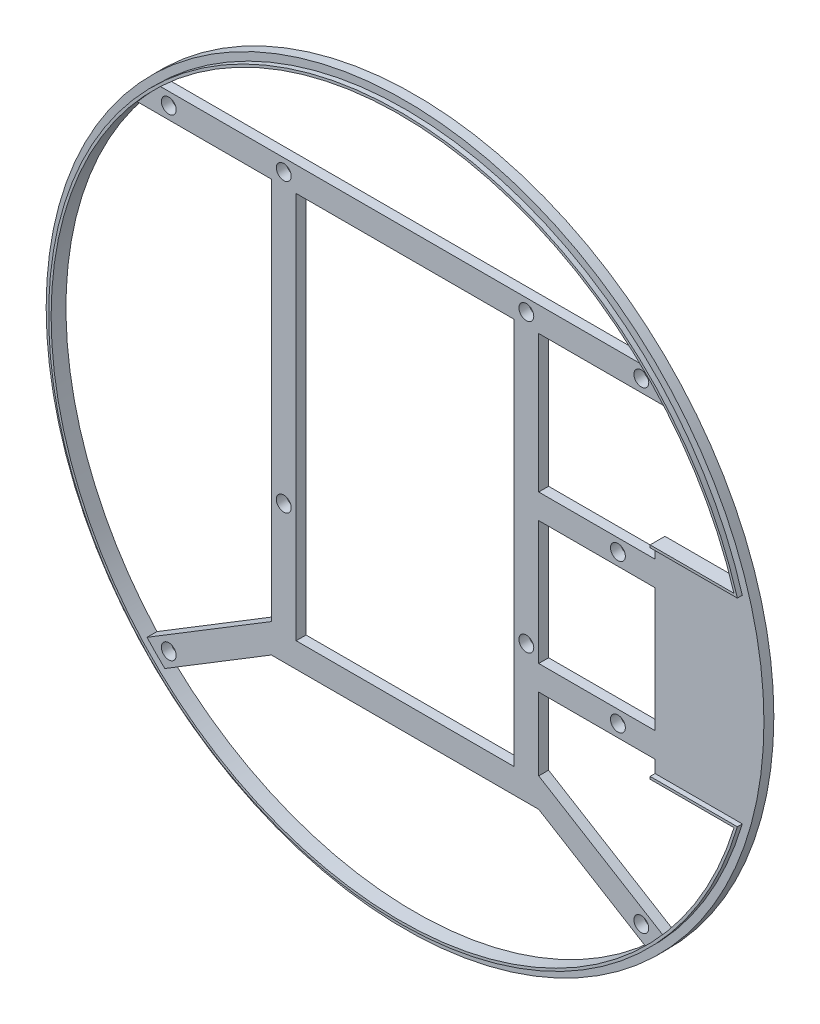
from build123d import *
from build123d.topology import SkipClean

# Parameters (mm, degrees)
SKIZZE1_R             = 72.5
SKIZZE1_R_2           = 70.5
BASE_RING_DEPTH       = 2
RASPBERRY_FRAME_DEPTH = 2
SCREWS_I_D            = 3
SKIZZE6_R             = 1.5
CAMERA_BEAM_DEPTH     = 2
BOTTOM_START          = -2
BOTTOM_COVER_DEPTH    = 2
INNER_RING_DEPTH      = 1


with BuildPart() as part:
    # Skizze1 → Base Ring (new body)
    with BuildSketch(Plane.XY):
        Circle(SKIZZE1_R)
        Circle(SKIZZE1_R_2, mode=Mode.SUBTRACT)
    extrude(amount=BASE_RING_DEPTH)

    # Skizze2 → Raspberry Frame (add)
    with BuildSketch(Plane.XY):
        with BuildLine():
            Line((0, 50.22970773), (-49.469449778, 50.22970773))
            ThreePointArc((-49.469449778, 50.22970773), (-51.834480078, 47.785318614), (-54.078864066, 45.22970773))
            Line((-54.078864066, 45.22970773), (-27, 45.22970773))
            Line((-27, 45.22970773), (-22, 45.22970773))
            Line((-22, 45.22970773), (0, 45.22970773))
            Line((0, 45.22970773), (0, 50.22970773))
        make_face()
        Polygon((-22, 45.22970773), (-27, 45.22970773), (-27, -32.164435383), (-27, -33.02029227), (-22, -33.02029227), align=None)
        with BuildLine():
            Line((-27, -32.164435383), (-52.117379441, -47.476612771))
            ThreePointArc((-52.117379441, -47.476612771), (-50.354632641, -49.34228381), (-48.5251414, -51.142552264))
            Line((-48.5251414, -51.142552264), (-27, -38.02029227))
            Line((-27, -38.02029227), (-27, -33.02029227))
            Line((-27, -33.02029227), (-27, -32.164435383))
        make_face()
        Polygon((-27, -33.02029227), (-27, -38.02029227), (0, -38.02029227), (0, -33.02029227), (-22, -33.02029227), align=None)
    raspberry_frame = extrude(amount=RASPBERRY_FRAME_DEPTH)

    # Screws I (through all)
    with Locations(Plane.XY.offset(2)):
        with Locations((-47.72970773, -47.72970773), (-24.5, -10.27029227), (-47.72970773, 47.72970773), (-24.5, 47.72970773)):
            screws_i = Hole(SCREWS_I_D / 2)

    # Mirror I: Raspberry Frame, Screws I across plane
    add(raspberry_frame.mirror(Plane(origin=(0, 0, 0), x_dir=(0, 0, 1), z_dir=(1, 0, 0))))
    add(screws_i.mirror(Plane(origin=(0, 0, 0), x_dir=(0, 0, 1), z_dir=(1, 0, 0))), mode=Mode.SUBTRACT)

    # Skizze6 → Camera Beam (add)
    # profile 1 of 2: a face of its own
    with BuildSketch(Plane.XY):
        with BuildLine():
            Line((68.293484316, 17.5), (27, 17.5))
            Line((27, 17.5), (27, 12.5))
            Line((27, 12.5), (69.382995035, 12.5))
            ThreePointArc((69.382995035, 12.5), (68.883620997, 15.009888687), (68.293484316, 17.5))
        make_face()
        with Locations((43, 15)):
            Circle(SKIZZE6_R, mode=Mode.SUBTRACT)
    # profile 2 of 2: a face of its own
    with BuildSketch(Plane.XY):
        with BuildLine():
            ThreePointArc((68.293484316, -17.5), (68.883620997, -15.009888687), (69.382995035, -12.5))
            Line((69.382995035, -12.5), (27, -12.5))
            Line((27, -12.5), (27, -17.5))
            Line((27, -17.5), (68.293484316, -17.5))
        make_face()
        with Locations((43, -15)):
            Circle(SKIZZE6_R, mode=Mode.SUBTRACT)
    extrude(amount=CAMERA_BEAM_DEPTH)

    # Skizze7 → Bottom Cover (add)
    with BuildSketch(Plane.XY.offset(2).offset(BOTTOM_START)):
        with BuildLine():
            Line((50.5, 12.5), (50.5, -12.5))
            Line((50.5, -12.5), (69.382995035, -12.5))
            ThreePointArc((69.382995035, -12.5), (70.220193496, -6.274904407), (70.5, -4.7e-08))
            ThreePointArc((70.5, -4.7e-08), (70.220193501, 6.27490436), (69.382995035, 12.5))
            Line((69.382995035, 12.5), (50.5, 12.5))
        make_face()
        with BuildLine():
            Line((50.5, 20.5), (50.5, 17.5))
            Line((50.5, 17.5), (68.293484316, 17.5))
            ThreePointArc((68.293484316, 17.5), (67.890158974, 19.00463929), (67.453687816, 20.5))
            Line((67.453687816, 20.5), (50.5, 20.5))
        make_face()
        with BuildLine():
            Line((50.5, -17.5), (50.5, -20.5))
            Line((50.5, -20.5), (67.453687816, -20.5))
            ThreePointArc((67.453687816, -20.5), (67.890158974, -19.00463929), (68.293484316, -17.5))
            Line((68.293484316, -17.5), (50.5, -17.5))
        make_face()
    extrude(amount=BOTTOM_COVER_DEPTH)

    # Skizze8 → Inner Ring (add)
    with SkipClean():  # the faces are left unmerged after this step: merging them gives an invalid solid
        with BuildSketch(Plane.XY.offset(2)):
            with BuildLine():
                Line((50.5, -20), (50.5, -20.5))
                Line((50.5, -20.5), (67.453687816, -20.5))
                ThreePointArc((67.453687816, -20.5), (-70.5, 0), (67.453687816, 20.5))
                Line((67.453687816, 20.5), (50.5, 20.5))
                Line((50.5, 20.5), (50.5, 20))
                Line((50.5, 20), (68.124885321, 20))
                ThreePointArc((68.124885321, 20), (-71, 0), (68.124885321, -20))
                Line((68.124885321, -20), (50.5, -20))
            make_face()
        extrude(amount=INNER_RING_DEPTH)


solid = part.part
